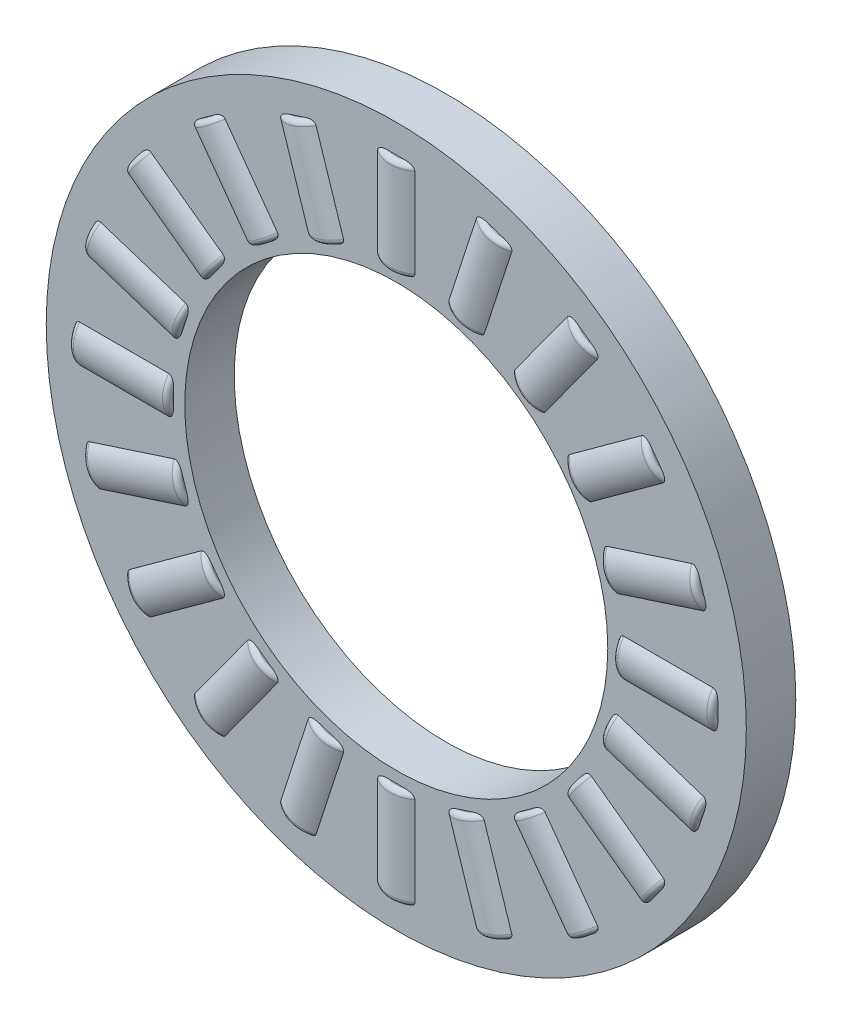
from build123d import *

# Parameters (mm, degrees)
SKETCH1_W         = 2
SKETCH1_H         = 5.6
CIRPATTERN1_COUNT = 20


with BuildPart() as part:
    # Sketch1 → Revolve1 (revolve)
    with BuildSketch(Plane(origin=(0, 0, 0), x_dir=(0, 0, -1), z_dir=(1, 0, 0))):
        with Locations((0, 11.35)):
            Rectangle(SKETCH1_W, SKETCH1_H)
    revolve(axis=Axis((0, 0, 0), (0, 0, -1)))

    # Sketch2 → Revolve2 (revolve)
    with BuildSketch(Plane(origin=(0, 0, 0), x_dir=(0, 0, -1), z_dir=(1, 0, 0))):
        with BuildLine():
            Line((0, 13), (1.05, 13))
            ThreePointArc((1.05, 13), (1.191421356, 12.941421356), (1.25, 12.8))
            Line((1.25, 12.8), (1.25, 9.2))
            ThreePointArc((1.25, 9.2), (1.191421356, 9.058578644), (1.05, 9))
            Line((1.05, 9), (0, 9))
            Line((0, 9), (0, 13))
        make_face()
    revolve2 = revolve(axis=Axis((0, 0, 0), (0, 1, 0)))

    # CirPattern1: Revolve2 ×20 about axis
    cirpattern1_axis = Axis((0, 0, 0), (0, 0, 1))
    for i in range(1, CIRPATTERN1_COUNT):
        add(revolve2.rotate(cirpattern1_axis, i * 360 / CIRPATTERN1_COUNT))


solid = part.part
